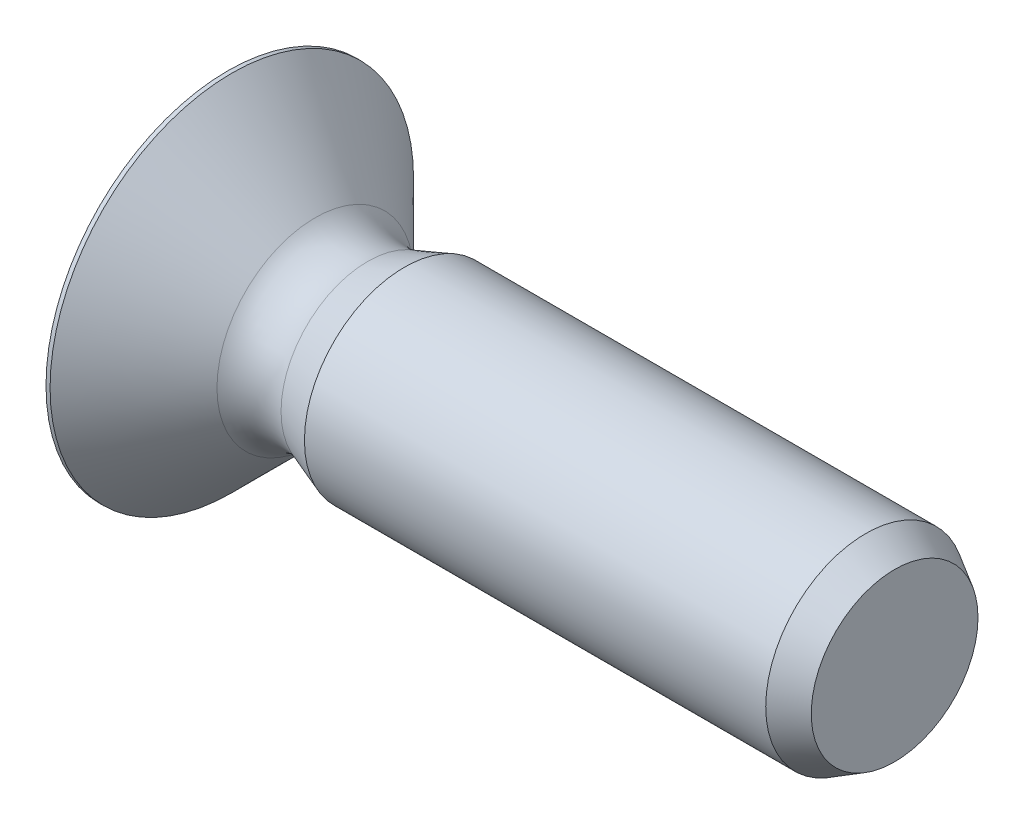
from build123d import *

# Parameters (mm, degrees)
CROSSRECESS_DEPTH = 1.65
DRAFT1_ANGLE      = 45
FILLET1_R         = 1.5


with BuildPart() as part:
    # Sketch1 → Base (revolve)
    with BuildSketch(Plane.XY):
        Polygon((20, 0), (20, 3), (5.3, 3), (3.3, 2.272059531), (0.122059531, 5.45), (0, 5.45), (0, 0), align=None)
    revolve(axis=Axis((-38.105406183, 0, 0), (1, 0, 0)))

    # Sketch2 → BaseEnd (revolve, cut)
    with BuildSketch(Plane(origin=(0, 0, 0), x_dir=(1, 0, 0), z_dir=(0, 1, 0))):
        Polygon((19.133974596, -3), (20, -2.5), (20, -3), align=None)
    revolve(axis=Axis((21.328193536, 0, 0), (-1, 0, 0)), mode=Mode.SUBTRACT)

    # Sketch3 → CrossRecess (cut)
    with BuildSketch(Plane(origin=(0, 0, 0), x_dir=(0, 0, -1), z_dir=(1, 0, 0))):
        Polygon((0.73, 3.65), (-0.73, 3.65), (-0.73, 0.73), (-3.65, 0.73), (-3.65, -0.73), (-0.73, -0.73), (-0.73, -3.65), (0.73, -3.65), (0.73, -0.73), (3.65, -0.73), (3.65, 0.73), (0.73, 0.73), align=None)
    extrude(amount=CROSSRECESS_DEPTH, mode=Mode.SUBTRACT)

    # Draft1
    draft1_faces = [part.faces().sort_by_distance(p)[0] for p in [
        (0.825, -3.65, 0),
        (0.825, 0, -3.65),
        (0.825, 0, 3.65),
        (0.825, 3.65, 0),
    ]]
    draft(draft1_faces, Plane(origin=(0, 5.45, 0), x_dir=(0, 0, -1), z_dir=(-1, 0, 0)), DRAFT1_ANGLE)

    # Fillet1
    fillet1_edges = [part.edges().sort_by_distance(p)[0] for p in [
        (3.3, -2.272059531, 0),
    ]]
    fillet(fillet1_edges, radius=FILLET1_R)


solid = part.part
